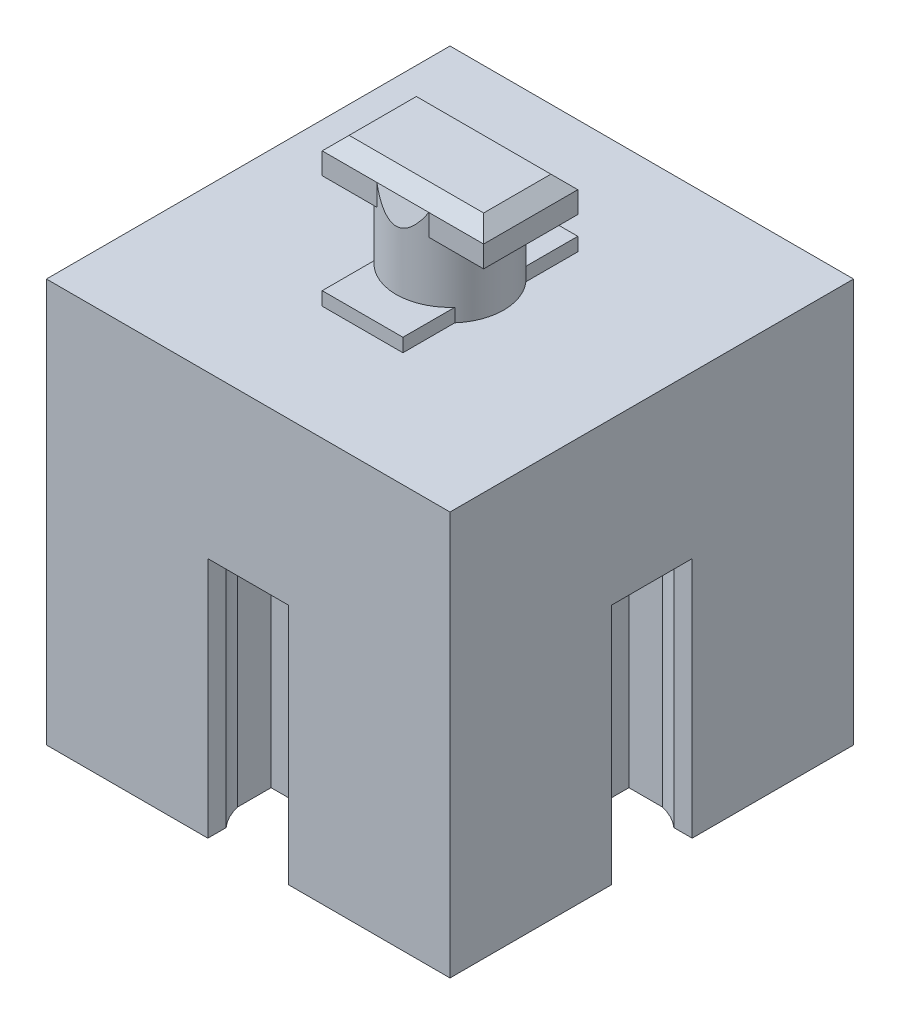
from build123d import *
from build123d.topology import SkipClean

# Parameters (mm, degrees)
SKETCH_1_W               = 15
SKETCH_1_H               = 15
EXTRUDE_1_DEPTH          = 15
CUT_EXTRUDE_1_DEPTH      = 9
SKETCH_4_W               = 3
SKETCH_4_H               = 6.5
EXTRUDE_2_DEPTH          = 0.5
EXTRUDE_3_DEPTH          = 2.2
EXTRUDE_3_DEPTH_BACK     = 0.5
SKETCH_6_R               = 2
SKETCH_7_W               = 6
SKETCH_7_H               = 3.5
EXTRUDE_4_DEPTH          = 1.3
EXTRUDE_START            = 0.8
SKETCH_8_R               = 2
EXTRUDE_5_DEPTH          = 0.8
CHAMFER_1_SIZE           = 0.5
CUT_EXTRUDE_2_DEPTH      = 2
CUT_EXTRUDE_2_DEPTH_BACK = 2
PATTERN_CIRCULAR_1_COUNT = 4
CUT_EXTRUDE_3_DEPTH      = 13.6


with BuildPart() as part:
    # 草图1 → 凸台-拉伸1 (new body)
    with BuildSketch(Plane(origin=(0, 0, 0), x_dir=(1, 0, 0), z_dir=(0, 1, 0))):
        Rectangle(SKETCH_1_W, SKETCH_1_H)
    extrude(amount=EXTRUDE_1_DEPTH)

    # 草图2 → 切除-拉伸1 (cut)
    with BuildSketch(Plane.XZ):
        with BuildLine():
            Line((1.5, 7.5), (-1.5, 7.5))
            Line((-1.5, 7.5), (-1.5, 6.822875656))
            ThreePointArc((-1.5, 6.822875656), (-1.780042303, 6.411838473), (-1.95, 5.944409721))
            Line((-1.95, 5.944409721), (-1.95, 4.7))
            Line((-1.95, 4.7), (1.95, 4.7))
            Line((1.95, 4.7), (1.95, 5.944409721))
            ThreePointArc((1.95, 5.944409721), (1.780042303, 6.411838473), (1.5, 6.822875656))
            Line((1.5, 6.822875656), (1.5, 7.5))
        make_face()
    cut_extrude_1 = extrude(amount=-CUT_EXTRUDE_1_DEPTH, mode=Mode.SUBTRACT)

    # 草图4 → 凸台-拉伸2 (add)
    with BuildSketch(Plane(origin=(0, 15, 0), x_dir=(1, 0, 0), z_dir=(0, 1, 0))):
        Rectangle(SKETCH_4_W, SKETCH_4_H)
    extrude(amount=EXTRUDE_2_DEPTH)

    # 草图6 → 凸台-拉伸3 (add, two sides: drawn at the far end of the back side and taken through both)
    with BuildSketch(Plane(origin=(0, 15.5, 0), x_dir=(1, 0, 0), z_dir=(0, 1, 0)).offset(-EXTRUDE_3_DEPTH_BACK)):
        with Locations(Location((0, 0, 0), (0, 0, 270))):
            Circle(SKETCH_6_R)
    extrude(amount=EXTRUDE_3_DEPTH + EXTRUDE_3_DEPTH_BACK)

    # 草图7 → 凸台-拉伸4 (add)
    with BuildSketch(Plane(origin=(0, 17.7, 0), x_dir=(1, 0, 0), z_dir=(0, 1, 0))):
        Rectangle(SKETCH_7_W, SKETCH_7_H)
    extrude(amount=EXTRUDE_4_DEPTH)

    # 草图8 → 凸台-拉伸5 (add)
    with SkipClean():  # the faces are left unmerged after this step: merging them gives an invalid solid
        with BuildSketch(Plane(origin=(0, 17.7, 0), x_dir=(1, 0, 0), z_dir=(0, 1, 0)).offset(EXTRUDE_START)):
            with Locations(Location((0, 0, 0), (0, 0, 298.955024372))):
                Circle(SKETCH_8_R)
        extrude(amount=-EXTRUDE_5_DEPTH)
    add(part.part.scale(1), mode=Mode.REPLACE)  # the faces are merged on a copy

    # 倒角1
    chamfer_1_edges = [part.edges().sort_by_distance(p)[0] for p in [
        (0, 19, -1.75),
        (-3, 19, 0),
        (0, 19, 1.75),
        (3, 19, 0),
    ]]
    chamfer(chamfer_1_edges, length=CHAMFER_1_SIZE - 0.0001)  # a hair under: the kernel refuses the full size

    # 草图9 → 切除-拉伸2 (cut, two sides: drawn at the far end of the back side and taken through both)
    with BuildSketch(Plane(origin=(0, 0, 0), x_dir=(0, 0, -1), z_dir=(1, 0, 0)).offset(-CUT_EXTRUDE_2_DEPTH_BACK)):
        Polygon((-2, 17.7), (-2, 18.5), (-1.75, 18.5), align=None)
        Polygon((1.75, 18.5), (2, 17.7), (2, 18.5), align=None)
    extrude(amount=CUT_EXTRUDE_2_DEPTH + CUT_EXTRUDE_2_DEPTH_BACK, mode=Mode.SUBTRACT)

    # 阵列(圆周)1: 切除-拉伸1 ×4 about axis
    pattern_circular_1_axis = Axis((0, 0, 0), (0, 1, 0))
    for i in range(1, PATTERN_CIRCULAR_1_COUNT):
        add(cut_extrude_1.rotate(pattern_circular_1_axis, i * 360 / PATTERN_CIRCULAR_1_COUNT), mode=Mode.SUBTRACT)

    # 草图10 → 切除-拉伸3 (cut)
    with BuildSketch(Plane.XZ):
        Polygon((6.8, 6.8), (6.8, 5.3), (4, 2.5), (4, -2.5), (6.8, -5.3), (6.8, -6.8), (5.3, -6.8), (2.5, -4), (-2.5, -4), (-5.3, -6.8), (-6.8, -6.8), (-6.8, -5.3), (-4, -2.5), (-4, 2.5), (-6.8, 5.3), (-6.8, 6.8), (-5.3, 6.8), (-2.5, 4), (2.5, 4), (5.3, 6.8), align=None)
    extrude(amount=-CUT_EXTRUDE_3_DEPTH, mode=Mode.SUBTRACT)


solid = part.part
